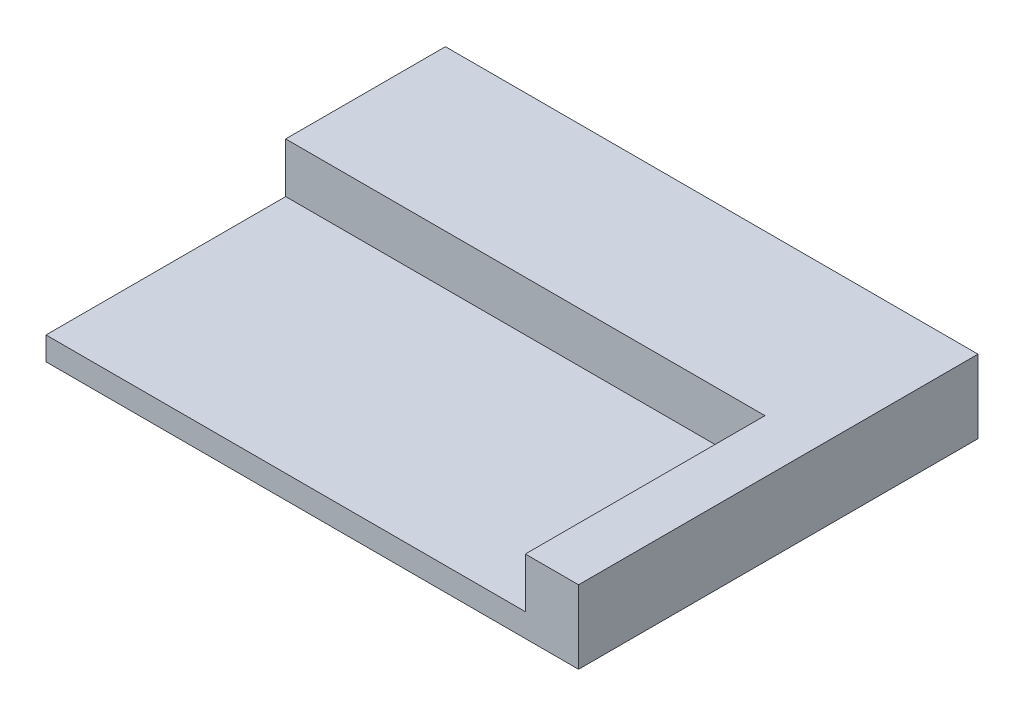
from build123d import *

# Parameters (mm, degrees)
SKETCH1_W           = 160
SKETCH1_H           = 120
BOSS_EXTRUDE1_DEPTH = 7
BOSS_EXTRUDE2_DEPTH = 15


with BuildPart() as part:
    # Sketch1 → Boss-Extrude1 (new body)
    with BuildSketch(Plane(origin=(0, 0, 0), x_dir=(1, 0, 0), z_dir=(0, 1, 0))):
        Rectangle(SKETCH1_W, SKETCH1_H)
    extrude(amount=BOSS_EXTRUDE1_DEPTH)

    # Sketch2 → Boss-Extrude2 (add)
    with BuildSketch(Plane(origin=(0, 7, 0), x_dir=(1, 0, 0), z_dir=(0, 1, 0))):
        Polygon((-80, 60), (-80, 12), (64, 12), (64, -60), (80, -60), (80, 60), align=None)
    extrude(amount=BOSS_EXTRUDE2_DEPTH)


solid = part.part
